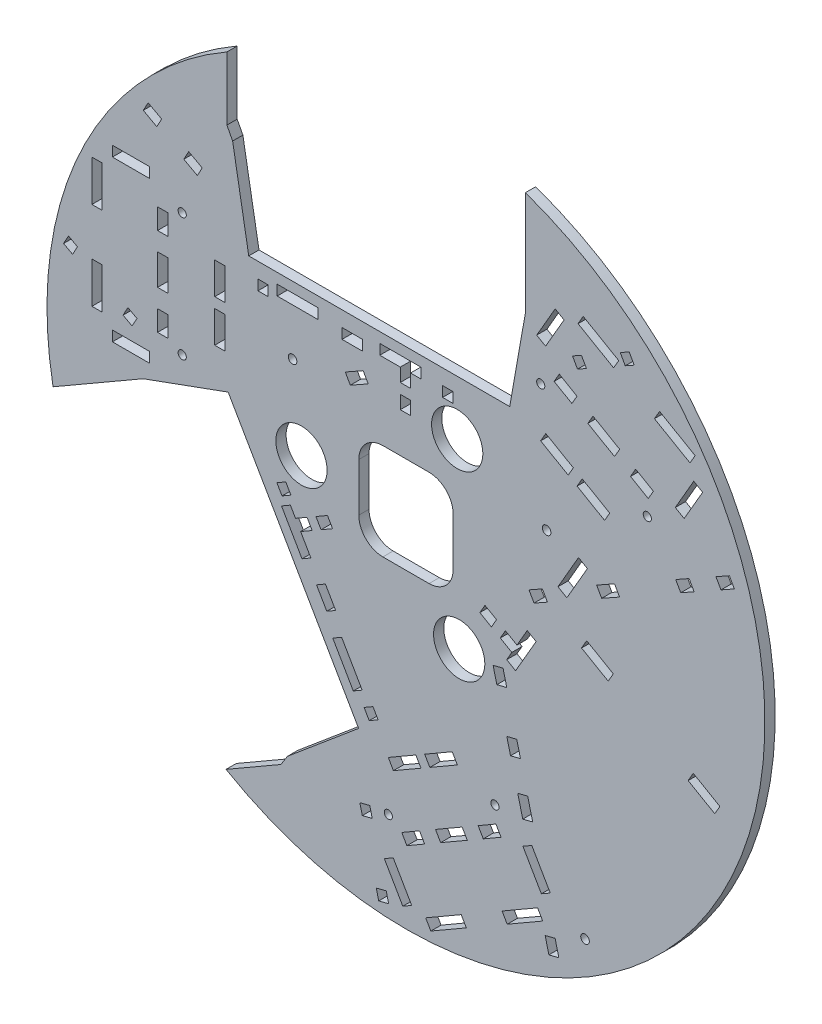
from build123d import *

# Parameters (mm, degrees)
ESQUISSE1_R                   = 175
BOSS_EXTRU_1_DEPTH            = 5
ESQUISSE2_W                   = 18
ESQUISSE2_H                   = 5
ESQUISSE2_W_2                 = 5
ESQUISSE2_H_2                 = 20
ESQUISSE2_H_3                 = 10
ESQUISSE2_H_4                 = 15
ESQUISSE2_H_5                 = 15.5
ESQUISSE2_W_3                 = 20
ESQUISSE2_H_6                 = 6.5
ENL_V_MAT_EXTRU_1_DEPTH       = 5
ESQUISSE6_R                   = 12.5
ENL_V_MAT_EXTRU_6_DEPTH       = 5
TROUS_DE_CENTRAGE_4_0MM1_D    = 4
HOLES_CATCHERS_OF_GLASS_DEPTH = 10
HOLES_BOARDS_SERVO_DEPTH      = 10
ESQUISSE11_W                  = 5
ESQUISSE11_H                  = 5
ESQUISSE11_W_2                = 10
ENL_V_MAT_EXTRU_7_DEPTH       = 5
TROU_TARAUD_M51_D             = 4.2


with BuildPart() as part:
    # Esquisse1 → Boss.-Extru.1 (new body)
    with BuildSketch(Plane.XY):
        with Locations((148.080426897, -12.110171348)):
            Circle(ESQUISSE1_R)
    extrude(amount=BOSS_EXTRU_1_DEPTH)

    # Esquisse2 → Enlèv. mat.-Extru.1 (cut)
    with BuildSketch(Plane.XY.offset(5)):
        Polygon((135.311788567, 53.777441362), (135.311788567, 48.777441362), (145.311788567, 48.777441362), (145.311788567, 42.277441362), (150.311788567, 42.277441362), (150.311788567, 48.777441362), (155.311788567, 48.777441362), (155.311788567, 53.777441362), align=None)
        with Locations((14, 69.777441362)):
            Rectangle(ESQUISSE2_W, ESQUISSE2_H)
        with Locations((-2.5, 52.277441362)):
            Rectangle(ESQUISSE2_W_2, ESQUISSE2_H_2)
        with Locations((-2.5, 9.277441362)):
            Rectangle(ESQUISSE2_W_2, ESQUISSE2_H_2)
        with Locations((14, -8.222558638)):
            Rectangle(ESQUISSE2_W, ESQUISSE2_H)
        with Locations((29.5, 9.277441362)):
            Rectangle(ESQUISSE2_W_2, ESQUISSE2_H_3)
        with Locations((29.5, 30.777441362)):
            Rectangle(ESQUISSE2_W_2, ESQUISSE2_H_4)
        with Locations((29.5, 52.277441362)):
            Rectangle(ESQUISSE2_W_2, ESQUISSE2_H_3)
        with Locations((57.36, 41.027441362)):
            Rectangle(ESQUISSE2_W_2, ESQUISSE2_H_5)
        with Locations((57.36, 20.527441362)):
            Rectangle(ESQUISSE2_W_2, ESQUISSE2_H_5)
        with Locations((95.311788567, 51.277441362)):
            Rectangle(ESQUISSE2_W_3, ESQUISSE2_H)
        with Locations((147.811788567, 34.027441362)):
            Rectangle(ESQUISSE2_W_2, ESQUISSE2_H_6)
        Polygon((292.702456717, 69.607306773), (283.702456717, 54.018849505), (279.372329698, 56.518849505), (288.372329698, 72.107306773), align=None)
        Polygon((289.042202679, 83.267560811), (286.542202679, 78.937433792), (269.221694603, 88.937433792), (271.721694603, 93.267560811), align=None)
        Polygon((251.803110316, 104.767560811), (249.303110316, 100.437433792), (231.982602241, 110.437433792), (234.482602241, 114.767560811), align=None)
        Polygon((225.152475222, 108.607306773), (216.152475222, 93.018849505), (211.822348203, 95.518849505), (220.822348203, 111.107306773), align=None)
        Polygon((231.472983297, 79.55474789), (228.972983297, 75.224620871), (220.31272926, 80.224620871), (222.81272926, 84.55474789), align=None)
        Polygon((252.257592988, 67.55474789), (249.757592988, 63.224620871), (236.767211932, 70.724620871), (239.267211932, 75.05474789), align=None)
        Polygon((268.71207566, 58.05474789), (266.21207566, 53.724620871), (257.551821622, 58.724620871), (260.051821622, 63.05474789), align=None)
        Polygon((247.420859728, 38.17728014), (244.920859728, 33.847153121), (231.497465969, 41.597153121), (233.997465969, 45.92728014), align=None)
        Polygon((229.66733895, 48.42728014), (227.16733895, 44.097153121), (213.743945192, 51.847153121), (216.243945192, 56.17728014), align=None)
        Polygon((211.525092463, -33.996012539), (207.194965444, -31.496012539), (202.194965444, -40.156266577), (196.56580032, -36.906266577), (194.06580032, -41.236393596), (199.694965444, -44.486393596), (197.194965444, -48.816520615), (201.525092463, -51.316520615), align=None)
        Polygon((236.525092463, 9.30525765), (226.525092463, -8.015250425), (222.194965444, -5.515250425), (232.194965444, 11.80525765), align=None)
        Polygon((192.235673301, -34.406266577), (189.735673301, -38.736393596), (184.106508176, -35.486393596), (186.606508176, -31.156266577), align=None)
        Polygon((146.538823973, -178.215262181), (137.538823973, -162.626804912), (141.868950992, -160.126804912), (150.868950992, -175.715262181), align=None)
        Polygon((160.199078011, -181.875516218), (157.699078011, -177.545389199), (175.019586086, -167.545389199), (177.519586086, -171.875516218), align=None)
        Polygon((197.438170373, -160.375516218), (194.938170373, -156.045389199), (212.258678449, -146.045389199), (214.758678449, -150.375516218), align=None)
        Polygon((214.088805468, -139.215262181), (205.088805468, -123.626804912), (209.418932487, -121.126804912), (218.418932487, -136.715262181), align=None)
        Polygon((185.768297392, -130.162703297), (183.268297392, -125.832576278), (191.92855143, -120.832576278), (194.42855143, -125.162703297), align=None)
        Polygon((164.983687701, -142.162703297), (162.483687701, -137.832576278), (175.474068758, -130.332576278), (177.974068758, -134.662703297), align=None)
        Polygon((148.52920503, -151.662703297), (146.02920503, -147.332576278), (154.689459067, -142.332576278), (157.189459067, -146.662703297), align=None)
        Polygon((141.960420962, -123.285235548), (139.460420962, -118.955108529), (152.88381472, -111.205108529), (155.38381472, -115.535235548), align=None)
        Polygon((159.713941739, -113.035235548), (157.213941739, -108.705108529), (170.637335498, -100.955108529), (173.137335498, -105.285235548), align=None)
        Polygon((97.404399659, -56.111942869), (101.734526678, -53.611942869), (96.734526678, -44.951688831), (102.363691803, -41.701688831), (99.863691803, -37.371561812), (94.234526678, -40.621561812), (91.734526678, -36.291434793), (87.404399659, -38.791434793), align=None)
        Polygon((122.404399659, -99.413213058), (112.404399659, -82.092704982), (116.734526678, -79.592704982), (126.734526678, -96.913213058), align=None)
        Polygon((106.693818822, -39.201688831), (104.193818822, -34.871561812), (109.822983946, -31.621561812), (112.322983946, -35.951688831), align=None)
    extrude(amount=-ENL_V_MAT_EXTRU_1_DEPTH, mode=Mode.SUBTRACT)

    # Esquisse6 → Enlèv. mat.-Extru.6 (cut)
    with BuildSketch(Plane.XY.offset(5)):
        Polygon((198.660831685, 58.777441362), (206.321253746, 102.221853729), (206.321253746, 185.563712918), (60.797190046, 185.563712918), (60.797190046, 108.682370842), (63.584787187, 103.348250546), (71.443823398, 58.777441362), align=None)
        Polygon((61.399751081, -3.750062223), (19.945575289, -18.838148298), (-52.230591968, -60.509077893), (20.531439882, -186.536613919), (87.112635197, -148.095942881), (90.338320311, -143.014752793), (125.008255225, -113.923223194), align=None)
        Polygon((249.16174886, -28.807411432), (236.171367804, -21.307411432), (233.671367804, -25.637538451), (246.66174886, -33.137538451), align=None)
        Polygon((301.123273088, -58.807411432), (288.132892031, -51.307411432), (285.632892031, -55.637538451), (298.623273088, -63.137538451), align=None)
        with BuildLine():
            Line((125.080426897, -0.360171348), (125.080426897, -23.860171348))
            ThreePointArc((125.080426897, -23.860171348), (128.521922218, -32.168676027), (136.830426897, -35.610171348))
            Line((136.830426897, -35.610171348), (159.330426897, -35.610171348))
            ThreePointArc((159.330426897, -35.610171348), (167.638931576, -32.168676027), (171.080426897, -23.860171348))
            Line((171.080426897, -23.860171348), (171.080426897, -0.360171348))
            ThreePointArc((171.080426897, -0.360171348), (167.638931576, 7.94833333), (159.330426897, 11.389828652))
            Line((159.330426897, 11.389828652), (136.830426897, 11.389828652))
            ThreePointArc((136.830426897, 11.389828652), (128.521922218, 7.94833333), (125.080426897, -0.360171348))
        make_face()
        with Locations((173.06, 32.277441362)):
            Circle(ESQUISSE6_R)
        with Locations((174.031440566, -55.936922587)):
            Circle(ESQUISSE6_R)
        with Locations((97.149840124, -12.67103282)):
            Circle(ESQUISSE6_R)
    extrude(amount=-ENL_V_MAT_EXTRU_6_DEPTH, mode=Mode.SUBTRACT)

    # Trous de centrage Ø4.0mm1 (through all)
    with Locations(Plane(origin=(148.080426897, -12.110171348, -78), x_dir=(1, 0, 0), z_dir=(0, 0, -1))):
        with Locations((65.70121345, -88.022614393), (117.662737677, -58.022614393), (-109.080426897, -72.887612711), (-109.080426897, -12.887612711), (-8.58231078, 130.910227103), (43.379213447, 100.910227103)):
            Hole(TROUS_DE_CENTRAGE_4_0MM1_D / 2)

    # Esquisse9 → Holes catchers of glass (cut)
    with BuildSketch(Plane.XY.offset(5)):
        Polygon((301.647255965, 32.874727734), (299.200467122, 37.235143352), (305.741090548, 40.905326617), (308.187879391, 36.544910999), align=None)
        Polygon((282.025385687, 21.864177939), (279.578596844, 26.224593557), (286.11922027, 29.894776822), (288.566009113, 25.534361204), align=None)
        Polygon((252.208863696, 5.133035829), (249.762074852, 9.493451446), (241.041243617, 4.599873759), (243.488032461, 0.239458142), align=None)
        Polygon((214.608404145, -10.232560209), (217.055192988, -14.592975826), (210.514569562, -18.263159091), (208.067780719, -13.902743474), align=None)
        Polygon((259.347334993, 106.606466519), (254.986919375, 104.159677675), (252.540130532, 108.520093293), (256.900546149, 110.966882136), align=None)
        Polygon((236.069559733, 93.544454591), (231.709144116, 91.097665748), (229.262355272, 95.458081365), (233.62277089, 97.904870209), align=None)
        Polygon((129.675418669, 33.842806815), (120.954587434, 28.949229128), (118.507798591, 33.309644745), (127.228629826, 38.203222432), align=None)
        Polygon((-16.43844555, 23.279140051), (-12.045948181, 20.890423478), (-14.434664754, 16.49792611), (-18.827162123, 18.886642683), align=None)
        Polygon((12.552037084, 7.51361067), (16.944534453, 5.124894098), (14.55581788, 0.732396729), (10.163320511, 3.121113302), align=None)
        Polygon((22.412737241, 98.907081949), (29.001483294, 95.32400709), (26.612766722, 90.931509721), (20.024020668, 94.514584581), align=None)
        Polygon((42.178975401, 88.157857372), (48.767721454, 84.574782512), (46.379004881, 80.182285143), (39.790258828, 83.765360003), align=None)
        Polygon((126.799616111, -149.834276272), (125.585690653, -144.983875775), (130.43609115, -143.769950316), (131.650016608, -148.620350813), align=None)
        Polygon((134.811524138, -181.846919552), (133.597598679, -176.996519055), (138.447999176, -175.782593596), (139.661924635, -180.632994093), align=None)
        Polygon((190.561972498, -54.501375823), (195.412372995, -53.287450364), (197.233261183, -60.56305111), (192.382860686, -61.776976568), align=None)
        Polygon((202.088963017, -79.964653097), (197.23856252, -81.178578556), (199.059450708, -88.454179302), (203.909851205, -87.240253843), align=None)
        Polygon((222.604303267, -161.936421496), (217.75390277, -163.150346955), (215.933014582, -155.874746209), (220.783415079, -154.660820751), align=None)
    extrude(amount=-HOLES_CATCHERS_OF_GLASS_DEPTH, mode=Mode.SUBTRACT)

    # Esquisse10 → Holes boards servo (cut)
    with BuildSketch(Plane.XY.offset(5)):
        Polygon((89.496120404, -27.614401399), (91.996120404, -31.944528418), (87.66720686, -34.443827818), (85.16720686, -30.113700799), align=None)
    extrude(amount=-HOLES_BOARDS_SERVO_DEPTH, mode=Mode.SUBTRACT)

    # Esquisse11 → Enlèv. mat.-Extru.7 (cut)
    with BuildSketch(Plane.XY.offset(5)):
        Polygon((109.482860628, -72.232450944), (104.482860628, -63.572196906), (108.812987647, -61.072196906), (113.812987647, -69.732450944), align=None)
        Polygon((130.165993385, -108.056687739), (134.496120404, -105.556687739), (131.996120404, -101.22656072), (127.665993385, -103.72656072), align=None)
        Polygon((207.430235035, -101.306415284), (209.858085952, -111.007216278), (205.007685455, -112.221141737), (202.579834538, -102.520340743), align=None)
        with Locations((168.425291316, 48.777441362)):
            Rectangle(ESQUISSE11_W, ESQUISSE11_H)
        with Locations((121.925291316, 48.777441362)):
            Rectangle(ESQUISSE11_W_2, ESQUISSE11_H)
        with Locations((78.425291316, 48.777441362)):
            Rectangle(ESQUISSE11_W, ESQUISSE11_H)
    extrude(amount=-ENL_V_MAT_EXTRU_7_DEPTH, mode=Mode.SUBTRACT)

    # Trou taraudé M51 (through all)
    with Locations(Plane(origin=(148.080426897, -12.110171348, 262), x_dir=(-1, 0, 0), z_dir=(0, 0, 1))):
        with Locations((-68.568956805, -27.662548456), (55.280905682, -37.98337033), (-87.299337242, 135.559338217)):
            Hole(TROU_TARAUD_M51_D / 2)


solid = part.part
